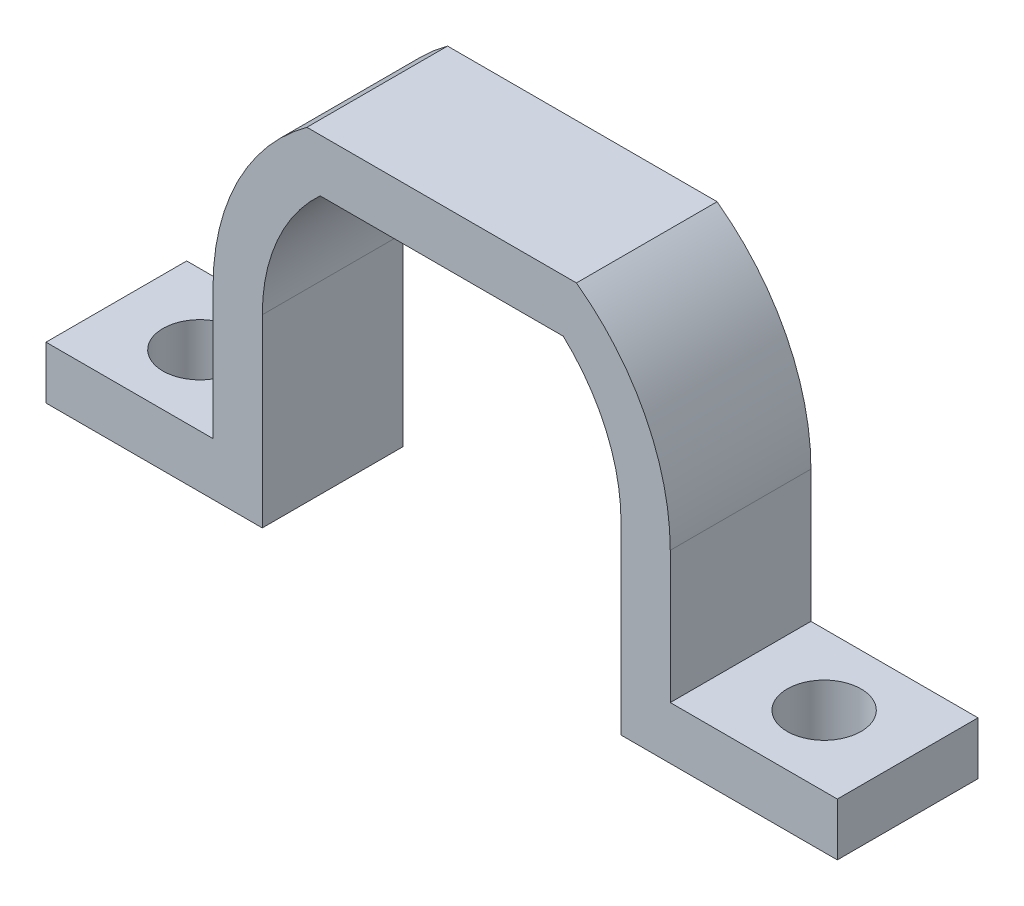
from build123d import *

# Parameters (mm, degrees)
CLAMP_DEPTH      = 8
SKETCH2_R        = 2.1
SCREW_HOLE_DEPTH = 30.904013109


with BuildPart() as part:
    # Sketch1 → Clamp (new body)
    with BuildSketch(Plane.XY):
        with BuildLine():
            Line((-6.913031173, 7.5), (6.913031173, 7.5))
            ThreePointArc((6.913031173, 7.5), (9.342187056, 4.09433035), (10.2, 0))
            Line((10.2, 0), (10.2, -10.5))
            Line((10.2, -10.5), (22.5, -10.5))
            Line((22.5, -10.5), (22.5, -7.5))
            Line((22.5, -7.5), (13, -7.5))
            Line((13, -7.5), (13, 0))
            ThreePointArc((13, 0), (11.589717709, 5.888840584), (7.664854858, 10.5))
            Line((7.664854858, 10.5), (-7.664854858, 10.5))
            ThreePointArc((-7.664854858, 10.5), (-11.589717709, 5.888840584), (-13, 0))
            Line((-13, 0), (-13, -7.5))
            Line((-13, -7.5), (-22.5, -7.5))
            Line((-22.5, -7.5), (-22.5, -10.5))
            Line((-22.5, -10.5), (-10.2, -10.5))
            Line((-10.2, -10.5), (-10.2, 0))
            ThreePointArc((-10.2, 0), (-9.342187056, 4.09433035), (-6.913031173, 7.5))
        make_face()
    extrude(amount=CLAMP_DEPTH)

    # Sketch2 → Screw Hole (cut, through all)
    with BuildSketch(Plane(origin=(0, -7.5, 0), x_dir=(1, 0, 0), z_dir=(0, 1, 0))):
        with Locations((-17.75, -4)):
            Circle(SKETCH2_R)
        with Locations((17.75, -4)):
            Circle(SKETCH2_R)
    extrude(amount=-SCREW_HOLE_DEPTH, mode=Mode.SUBTRACT)


solid = part.part
